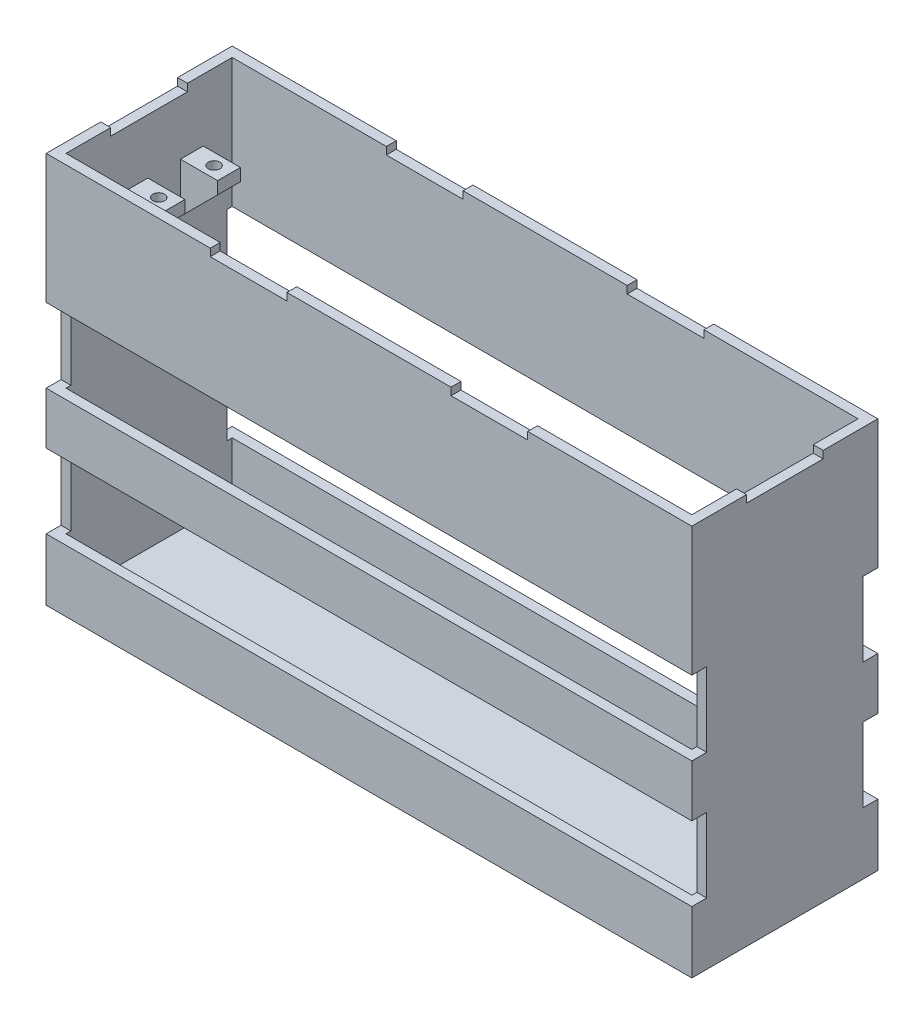
from build123d import *

# Parameters (mm, degrees)
SKETCH1_W                        = 261
SKETCH1_H                        = 75.2
BOSS_EXTRUDE1_DEPTH              = 3.175
SKETCH2_W                        = 261
SKETCH2_H                        = 75.2
SKETCH2_W_2                      = 253
SKETCH2_H_2                      = 67.2
BOSS_EXTRUDE2_DEPTH              = 155
SKETCH3_W                        = 6
SKETCH3_H                        = 30
CUT_EXTRUDE1_DEPTH               = 308.496488801
SKETCH4_W                        = 9.2
SKETCH4_H                        = 20
BOSS_EXTRUDE3_DEPTH              = 15
CHAMFER2_SIZE                    = 15
F_13_0_185_DIAMETER_HOLE1_REACH  = 192.087
F_13_0_185_DIAMETER_HOLE1_BORE_R = 2.3495
LPATTERN1_COUNT                  = 3
LPATTERN1_PITCH                  = 22.4
SKETCH7_W                        = 4
SKETCH7_H                        = 15.5
SKETCH7_W_2                      = 31
SKETCH7_H_2                      = 4
CUT_EXTRUDE2_DEPTH               = 3


# Read off the part's stored shape, not the designer's step: Mirror2
with BuildPart() as part:
    # Sketch1 → Boss-Extrude1 (new body)
    with BuildSketch(Plane(origin=(0, 0, 0), x_dir=(1, 0, 0), z_dir=(0, 1, 0))):
        Rectangle(SKETCH1_W, SKETCH1_H)
    extrude(amount=BOSS_EXTRUDE1_DEPTH)

    # Sketch2 → Boss-Extrude2 (add)
    with BuildSketch(Plane(origin=(0, 3.175, 0), x_dir=(1, 0, 0), z_dir=(0, 1, 0))):
        Rectangle(SKETCH2_W, SKETCH2_H)
        Rectangle(SKETCH2_W_2, SKETCH2_H_2, mode=Mode.SUBTRACT)
    extrude(amount=BOSS_EXTRUDE2_DEPTH)

    # Sketch3 → Cut-Extrude1 (cut, through all)
    with BuildSketch(Plane(origin=(130.5, 0, 0), x_dir=(0, 0, -1), z_dir=(1, 0, 0))):
        with Locations((-34.6, 91)):
            Rectangle(SKETCH3_W, SKETCH3_H)
        with Locations((-34.6, 40)):
            Rectangle(SKETCH3_W, SKETCH3_H)
    cut_extrude1 = extrude(amount=-CUT_EXTRUDE1_DEPTH, mode=Mode.SUBTRACT)

    # Mirror1: Cut-Extrude1 across plane
    add(cut_extrude1.mirror(Plane.XY), mode=Mode.SUBTRACT)

    # Sketch4 → Boss-Extrude3 (add)
    with BuildSketch(Plane.ZY.offset(-126.5)):
        with Locations((-17.3, 123)):
            Rectangle(SKETCH4_W, SKETCH4_H)
        with Locations((27.5, 123)):
            Rectangle(SKETCH4_W, SKETCH4_H)
        with Locations((5.1, 123)):
            Rectangle(SKETCH4_W, SKETCH4_H)
    extrude(amount=BOSS_EXTRUDE3_DEPTH)

    # Chamfer2
    chamfer2_edges = [part.edges().sort_by_distance(p)[0] for p in [
        (111.5, 113, 27.5),
        (111.5, 113, 5.1),
        (111.5, 113, -17.3),
    ]]
    chamfer(chamfer2_edges, length=CHAMFER2_SIZE - 0.0001)  # a hair under: the kernel refuses the full size

    # #13 (0.185) Diameter Hole1 bore → #13 (0.185) Diameter Hole1 (cut, up to next)
    with BuildSketch(Plane(origin=(0, 133, 0), x_dir=(1, 0, 0), z_dir=(0, 1, 0)), mode=Mode.PRIVATE) as f_13_0_185_diameter_hole1_sk1:
        with Locations((117.5, -27.5)):
            Circle(F_13_0_185_DIAMETER_HOLE1_BORE_R)
    f_13_0_185_diameter_hole1_tool1 = extrude(f_13_0_185_diameter_hole1_sk1.sketch, amount=-F_13_0_185_DIAMETER_HOLE1_REACH, mode=Mode.PRIVATE) & part.part
    f_13_0_185_diameter_hole1 = f_13_0_185_diameter_hole1_tool1.solids().sort_by_distance((117.5, 133, 27.5))[0]
    add(f_13_0_185_diameter_hole1, mode=Mode.SUBTRACT)

    # LPattern1: #13 (0.185) Diameter Hole1 ×3
    with Locations(*[(0, 0, -i * LPATTERN1_PITCH) for i in range(1, LPATTERN1_COUNT)]):
        add(f_13_0_185_diameter_hole1, mode=Mode.SUBTRACT)

    # Mirror2: part across plane


with BuildPart() as part_1:
    add(part.part)
    add(part.part.mirror(Plane(origin=(0, 0, 0), x_dir=(0, 0, 1), z_dir=(1, 0, 0))))

    # Sketch7 → Cut-Extrude2 (cut)
    with BuildSketch(Plane(origin=(0, 158.175, 0), x_dir=(1, 0, 0), z_dir=(0, 1, 0))):
        with Locations((128.5, 7.75)):
            Rectangle(SKETCH7_W, SKETCH7_H)
        with Locations((48.666666667, 35.6)):
            Rectangle(SKETCH7_W_2, SKETCH7_H_2)
        with Locations((-128.5, 7.75)):
            Rectangle(SKETCH7_W, SKETCH7_H)
        with Locations((-48.666666667, 35.6)):
            Rectangle(SKETCH7_W_2, SKETCH7_H_2)
    cut_extrude2 = extrude(amount=-CUT_EXTRUDE2_DEPTH, mode=Mode.SUBTRACT)

    # Mirror3: Cut-Extrude2 across plane
    add(cut_extrude2.mirror(Plane.XY), mode=Mode.SUBTRACT)


solid = part_1.part
